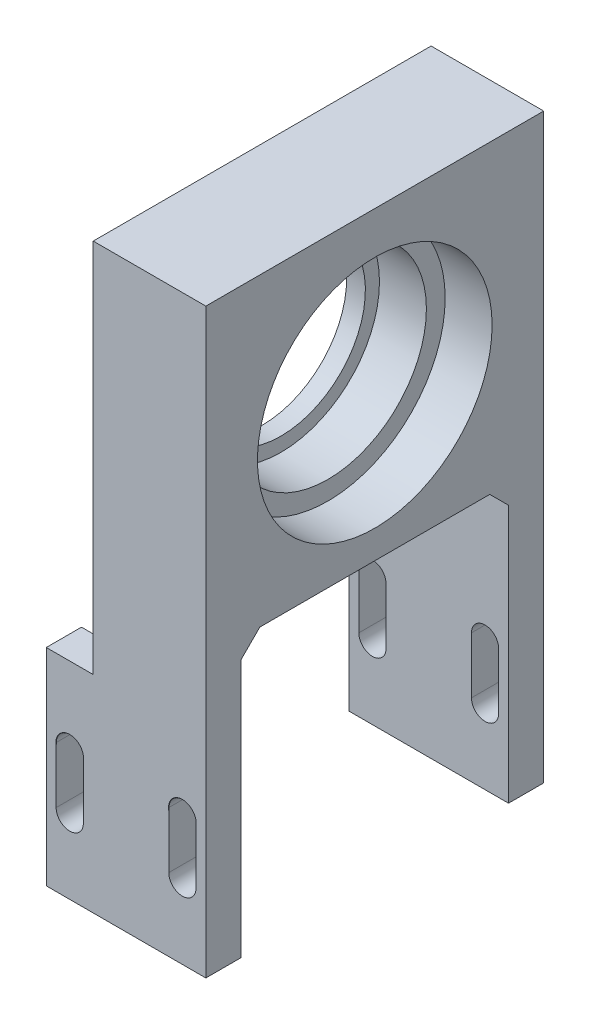
from build123d import *

# Parameters (mm, degrees)
BOSS_EXTRUDE1_DEPTH              = 36
SKETCH2_R                        = 10.5
CUT_EXTRUDE1_DEPTH               = 74.681748079
SKETCH3_W                        = 28.5
SKETCH3_H                        = 29.5
CUT_EXTRUDE2_DEPTH               = 74.681748079
CHAMFER1_SIZE                    = 2
BOSS_EXTRUDE2_START              = -2
SKETCH6_R                        = 10.5
SKETCH6_R_2                      = 9
BOSS_EXTRUDE2_DEPTH              = 2
SKETCH10_R                       = 15
SKETCH10_R_2                     = 11
CUT_EXTRUDE4_DEPTH               = 0.6
SKETCH11_R                       = 12.5
CUT_EXTRUDE5_DEPTH               = 5
M2_5_CLEARANCE_HOLE1_D           = 2.9
M2_5_CLEARANCE_HOLE1_CSINK_D     = 2.95
M2_5_CLEARANCE_HOLE1_CSINK_ANGLE = 90
CUT_EXTRUDE6_DEPTH               = 74.681748079


with BuildPart() as part:
    # Sketch1 → Boss-Extrude1 (new body)
    with BuildSketch(Plane.XY):
        Polygon((0, 0), (17, 0), (17, 29), (17, 62), (5, 62), (5, 22), (0, 22), align=None)
    extrude(amount=BOSS_EXTRUDE1_DEPTH)

    # Sketch2 → Cut-Extrude1 (cut, through all)
    with BuildSketch(Plane(origin=(17, 0, 0), x_dir=(0, 0, -1), z_dir=(1, 0, 0))):
        with Locations((-18, 45)):
            Circle(SKETCH2_R)
    extrude(amount=-CUT_EXTRUDE1_DEPTH, mode=Mode.SUBTRACT)

    # Sketch3 → Cut-Extrude2 (cut, through all)
    with BuildSketch(Plane(origin=(17, 0, 0), x_dir=(0, 0, -1), z_dir=(1, 0, 0))):
        with Locations((-18, 14.75)):
            Rectangle(SKETCH3_W, SKETCH3_H)
    extrude(amount=-CUT_EXTRUDE2_DEPTH, mode=Mode.SUBTRACT)

    # Chamfer1
    chamfer1_edges = [part.edges().sort_by_distance(p)[0] for p in [
        (11, 29.5, 32.25),
        (11, 29.5, 3.75),
    ]]
    chamfer(chamfer1_edges, length=CHAMFER1_SIZE)

    # Sketch6 → Boss-Extrude2 (add)
    with BuildSketch(Plane.ZY.offset(-5).offset(BOSS_EXTRUDE2_START)):
        with Locations((18, 45)):
            Circle(SKETCH6_R)
        with Locations((18, 45)):
            Circle(SKETCH6_R_2, mode=Mode.SUBTRACT)
    extrude(amount=BOSS_EXTRUDE2_DEPTH)

    # Sketch10 → Cut-Extrude4 (cut)
    with BuildSketch(Plane.ZY.offset(-5)):
        with Locations((18, 45)):
            Circle(SKETCH10_R)
        with Locations((18, 45)):
            Circle(SKETCH10_R_2, mode=Mode.SUBTRACT)
    extrude(amount=-CUT_EXTRUDE4_DEPTH, mode=Mode.SUBTRACT)

    # Sketch11 → Cut-Extrude5 (cut)
    with BuildSketch(Plane(origin=(17, 0, 0), x_dir=(0, 0, -1), z_dir=(1, 0, 0))):
        with Locations((-18, 45)):
            Circle(SKETCH11_R)
    extrude(amount=-CUT_EXTRUDE5_DEPTH, mode=Mode.SUBTRACT)

    # M2.5 Clearance Hole1 (through all)
    with Locations(Plane.XY.offset(36)):
        with Locations((14.5, 13.75), (2.5, 13.75)):
            CounterSinkHole(M2_5_CLEARANCE_HOLE1_D / 2, M2_5_CLEARANCE_HOLE1_CSINK_D / 2, counter_sink_angle=M2_5_CLEARANCE_HOLE1_CSINK_ANGLE)

    # Sketch15 → Cut-Extrude6 (cut, through all)
    with BuildSketch(Plane(origin=(0, 0, 0), x_dir=(-1, 0, 0), z_dir=(0, 0, -1))):
        with BuildLine():
            Line((-13.05, 13.75), (-13.05, 7.75))
            ThreePointArc((-13.05, 7.75), (-14.5, 6.3), (-15.95, 7.75))
            Line((-15.95, 7.75), (-15.95, 13.75))
            ThreePointArc((-15.95, 13.75), (-14.5, 15.2), (-13.05, 13.75))
        make_face()
        with BuildLine():
            Line((-1.05, 13.75), (-1.05, 7.75))
            ThreePointArc((-1.05, 7.75), (-2.5, 6.3), (-3.95, 7.75))
            Line((-3.95, 7.75), (-3.95, 13.75))
            ThreePointArc((-3.95, 13.75), (-2.5, 15.2), (-1.05, 13.75))
        make_face()
    extrude(amount=-CUT_EXTRUDE6_DEPTH, mode=Mode.SUBTRACT)


solid = part.part
